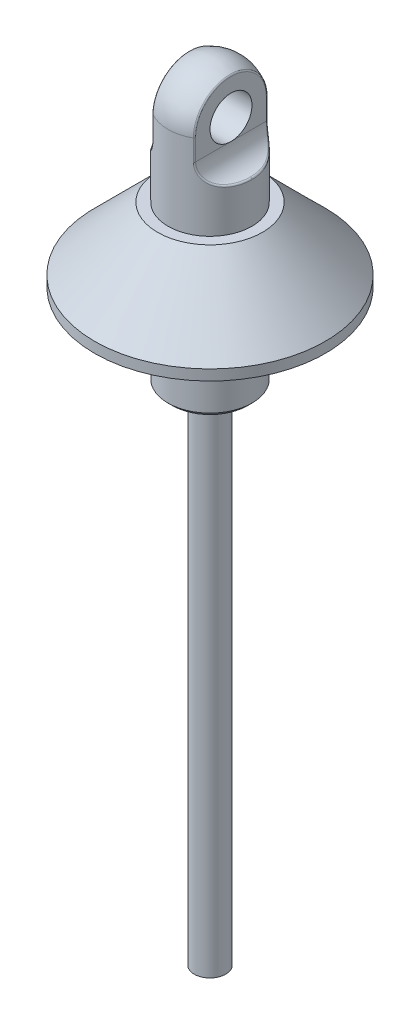
from build123d import *

# Parameters (mm, degrees)
SKETCH1_R           = 34.925
BOSS_EXTRUDE1_DEPTH = 3.175
SKETCH2_R           = 34.925
BOSS_EXTRUDE2_DEPTH = 19.05
BOSS_EXTRUDE2_TAPER = 45
SKETCH3_R           = 12.7
BOSS_EXTRUDE3_DEPTH = 25.4
DOME1_FACE_RADIUS   = 12.7
DOME1_HEIGHT        = 12.7
SKETCH4_W           = 11.619385301
SKETCH4_H           = 25.4
CUT_EXTRUDE2_DEPTH  = 28.575
FILLET2_R           = 6.35
SKETCH5_R           = 6.35
CUT_EXTRUDE3_DEPTH  = 82.009177815
FILLET3_R           = 0.508
BOSS_EXTRUDE4_START = 25.4
SKETCH6_R           = 12.7
BOSS_EXTRUDE4_DEPTH = 25.4
CHAMFER1_SIZE       = 1.27
SKETCH7_R           = 4.7625
BOSS_EXTRUDE5_DEPTH = 152.4


with BuildPart() as part:
    # Sketch1 → Boss-Extrude1 (new body)
    with BuildSketch(Plane(origin=(0, 0, 0), x_dir=(1, 0, 0), z_dir=(0, 1, 0))):
        with Locations(Location((0, 0, 0), (0, 0, 270))):
            Circle(SKETCH1_R)
    extrude(amount=BOSS_EXTRUDE1_DEPTH)

    # Sketch2 → Boss-Extrude2 (add)
    with BuildSketch(Plane(origin=(0, 3.175, 0), x_dir=(1, 0, 0), z_dir=(0, 1, 0))):
        with Locations(Location((0, 0, 0), (0, 0, 270))):
            Circle(SKETCH2_R)
    extrude(amount=BOSS_EXTRUDE2_DEPTH, taper=BOSS_EXTRUDE2_TAPER)

    # Sketch3 → Boss-Extrude3 (add)
    with BuildSketch(Plane(origin=(0, 22.225, 0), x_dir=(1, 0, 0), z_dir=(0, 1, 0))):
        with Locations(Location((0, 0, 0), (0, 0, 270))):
            Circle(SKETCH3_R)
    extrude(amount=BOSS_EXTRUDE3_DEPTH)

    # Dome1: a dome of height H over a round flat face of radius A is a cap of a sphere of radius (A * A + H * H) / (2 * H)
    dome1_r = (DOME1_FACE_RADIUS * DOME1_FACE_RADIUS + DOME1_HEIGHT * DOME1_HEIGHT) / (2 * DOME1_HEIGHT)
    dome1_base = Plane((0, 47.625, 0), z_dir=(0, 1, 0))
    with Locations(dome1_base.offset(DOME1_HEIGHT - dome1_r)):
        dome1_ball = Sphere(dome1_r, mode=Mode.PRIVATE)
    add(split(dome1_ball, bisect_by=dome1_base, keep=Keep.TOP, mode=Mode.PRIVATE))

    # Sketch4 → Cut-Extrude2 (cut)
    with BuildSketch(Plane(origin=(0, 63.5, 0), x_dir=(1, 0, 0), z_dir=(0, 1, 0))):
        with Locations((-12.159692651, 0)):
            Rectangle(SKETCH4_W, SKETCH4_H)
        with Locations((12.159692651, 0)):
            Rectangle(SKETCH4_W, SKETCH4_H)
    extrude(amount=-CUT_EXTRUDE2_DEPTH, mode=Mode.SUBTRACT)

    # Fillet2
    fillet2_edges = [part.edges().sort_by_distance(p)[0] for p in [
        (6.35, 34.925, 0),
        (-6.35, 34.925, 0),
    ]]
    fillet(fillet2_edges, radius=FILLET2_R - 0.0001)  # a hair under: the kernel refuses the full size

    # Sketch5 → Cut-Extrude3 (cut, through all)
    with BuildSketch(Plane(origin=(6.35, 0, 0), x_dir=(0, 0, -1), z_dir=(1, 0, 0))):
        with Locations(Location((0, 47.625, 0), (0, 0, 270))):
            Circle(SKETCH5_R)
    extrude(amount=-CUT_EXTRUDE3_DEPTH, mode=Mode.SUBTRACT)

    # Fillet3
    fillet3_edges = [part.edges().sort_by_distance(p)[0] for p in [
        (-6.35, 58.623522628, 0),
        (-6.35, 44.44995, 10.998522628),
        (6.35, 58.623522628, 0),
        (6.35, 44.44995, -10.998522628),
        (6.35, 44.44995, 10.998522628),
        (-6.35, 44.44995, -10.998522628),
        (10.094783009, 35.483993727, 7.706189461),
        (10.094783009, 35.483993727, -7.706189461),
        (-10.094783009, 35.483993727, -7.706189461),
        (-10.094783009, 35.483993727, 7.706189461),
    ]]
    fillet(fillet3_edges, radius=FILLET3_R)

    # Sketch6 → Boss-Extrude4 (add)
    with BuildSketch(Plane.XZ.offset(BOSS_EXTRUDE4_START)):
        with Locations(Location((0, 0, 0), (0, 0, 298.630989837))):
            Circle(SKETCH6_R)
    extrude(amount=-BOSS_EXTRUDE4_DEPTH)

    # Chamfer1
    chamfer1_edges = [part.edges().sort_by_distance(p)[0] for p in [
        (-6.085416667, -25.4, 11.147093971),
    ]]
    chamfer(chamfer1_edges, length=CHAMFER1_SIZE)

    # Sketch7 → Boss-Extrude5 (add)
    with BuildSketch(Plane.XZ.offset(25.4)):
        with Locations(Location((0, 0, 0), (0, 0, 90))):
            Circle(SKETCH7_R)
    extrude(amount=BOSS_EXTRUDE5_DEPTH)


solid = part.part
